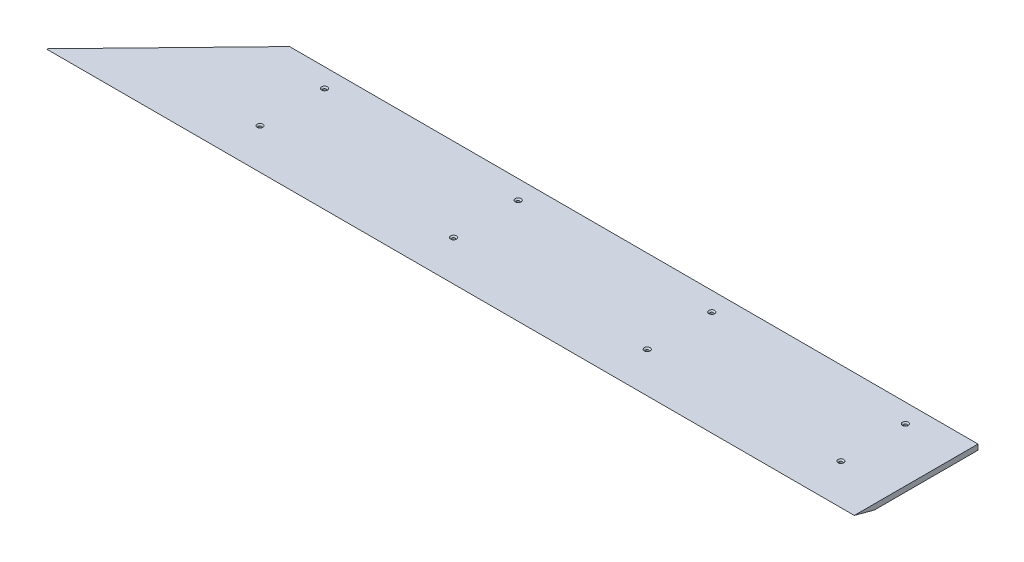
from build123d import *

# Parameters (mm, degrees)
BOSS_EXTRUDE1_DEPTH                                 = 12.7
CHAMFER1_SIZE2                                      = 47.397045256
CHAMFER1_SIZE                                       = 12.7
CSK_FOR_1_4_FLAT_HEAD_MACHINE_SCREW_100_D           = 7.14248
CSK_FOR_1_4_FLAT_HEAD_MACHINE_SCREW_100_CSINK_D     = 13.716
CSK_FOR_1_4_FLAT_HEAD_MACHINE_SCREW_100_CSINK_ANGLE = 100
LPATTERN1_COUNT                                     = 4
LPATTERN1_PITCH                                     = 457.2


with BuildPart() as part:
    # Sketch1 → Boss-Extrude1 (new body)
    with BuildSketch(Plane(origin=(0, 0, 0), x_dir=(1, 0, 0), z_dir=(0, 1, 0))):
        Polygon((-812.8, 0), (812.8, 0), (812.8, -292.1), (-1095.864592562, -292.1), align=None)
    extrude(amount=BOSS_EXTRUDE1_DEPTH)

    # Chamfer1
    chamfer1_edges = [part.edges().sort_by_distance(p)[0] for p in [
        (-141.532296281, 0, 292.1),
    ]]
    chamfer1_side = [part.faces().sort_by_distance(p)[0] for p in [
        (-141.532296281, 0.254, 292.1),
    ]]
    chamfer(chamfer1_edges, length=CHAMFER1_SIZE - 0.0001, length2=CHAMFER1_SIZE2 - 0.0001, reference=chamfer1_side[0])  # a hair under: the kernel refuses the full size

    # CSK for 1/4 Flat Head Machine Screw (100)1 (through all)
    with Locations(Plane(origin=(0, 12.7, 0), x_dir=(1, 0, 0), z_dir=(0, 1, 0))):
        with Locations((-685.8, -44.45), (-685.8, -196.85)):
            csk_for_1_4_flat_head_machine_screw_100 = CounterSinkHole(CSK_FOR_1_4_FLAT_HEAD_MACHINE_SCREW_100_D / 2, CSK_FOR_1_4_FLAT_HEAD_MACHINE_SCREW_100_CSINK_D / 2, counter_sink_angle=CSK_FOR_1_4_FLAT_HEAD_MACHINE_SCREW_100_CSINK_ANGLE)

    # LPattern1: CSK for 1/4 Flat Head Machine Screw (100)1 ×4
    with Locations(*[(i * LPATTERN1_PITCH, 0, 0) for i in range(1, LPATTERN1_COUNT)]):
        add(csk_for_1_4_flat_head_machine_screw_100, mode=Mode.SUBTRACT)


solid = part.part
